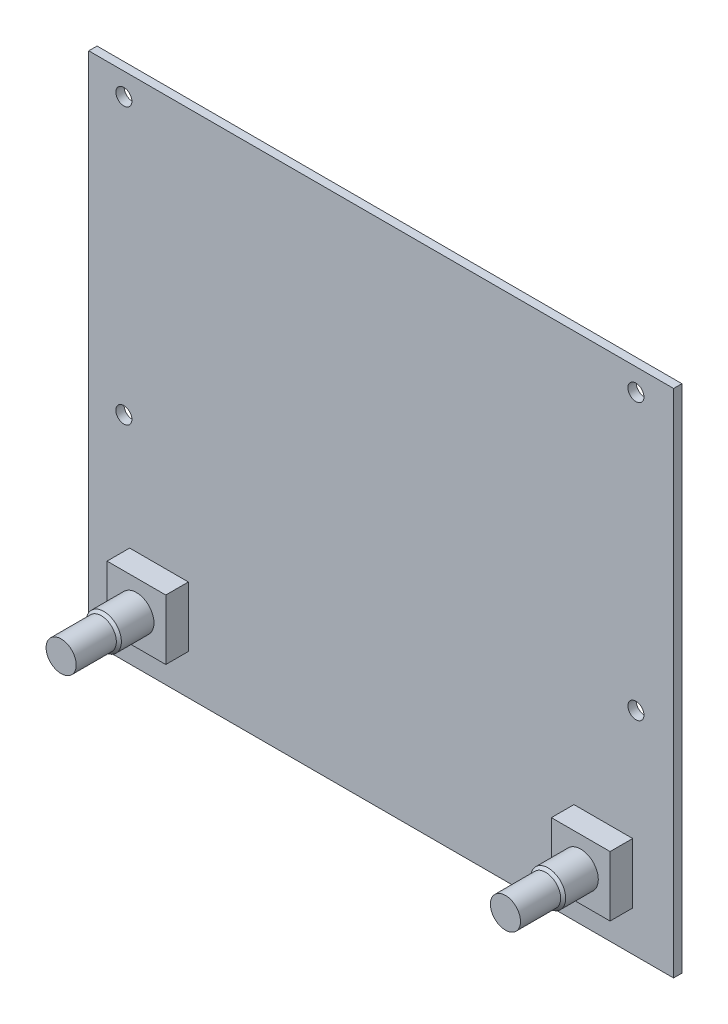
from build123d import *

# Parameters (mm, degrees)
SKETCH1_W           = 116.54028
SKETCH1_H           = 101.7397
SKETCH1_R           = 1.6002
BOSS_EXTRUDE1_DEPTH = 1.65608
SKETCH2_W           = 11.69924
SKETCH2_H           = 11.99896
BOSS_EXTRUDE2_DEPTH = 4.5
SKETCH3_R           = 3.5
BOSS_EXTRUDE3_DEPTH = 7
CHAMFER1_SIZE       = 0.5
SKETCH5_R           = 3
BOSS_EXTRUDE4_DEPTH = 8
SKETCH6_W           = 77.0509
SKETCH6_H           = 20.6502
CUT_EXTRUDE1_DEPTH  = 1


with BuildPart() as part:
    # Sketch1 → Boss-Extrude1 (new body)
    with BuildSketch(Plane.XY):
        Rectangle(SKETCH1_W, SKETCH1_H)
        with Locations((-51.2699, 46.45025)):
            Circle(SKETCH1_R, mode=Mode.SUBTRACT)
        with Locations((50.76952, 46.45025)):
            Circle(SKETCH1_R, mode=Mode.SUBTRACT)
        with Locations((50.76952, -8.44931)):
            Circle(SKETCH1_R, mode=Mode.SUBTRACT)
        with Locations((-51.2699, -8.44931)):
            Circle(SKETCH1_R, mode=Mode.SUBTRACT)
    extrude(amount=BOSS_EXTRUDE1_DEPTH)

    # Sketch2 → Boss-Extrude2 (add)
    with BuildSketch(Plane.XY.offset(1.65608)):
        with Locations((-44.26966, -36.86937)):
            Rectangle(SKETCH2_W, SKETCH2_H)
        with Locations((44.26966, -36.86937)):
            Rectangle(SKETCH2_W, SKETCH2_H)
    extrude(amount=BOSS_EXTRUDE2_DEPTH)

    # Sketch3 → Boss-Extrude3 (add)
    with BuildSketch(Plane.XY.offset(6.15608)):
        with Locations((-44.26966, -36.86937)):
            Circle(SKETCH3_R)
        with Locations((44.26966, -36.86937)):
            Circle(SKETCH3_R)
    extrude(amount=BOSS_EXTRUDE3_DEPTH)

    # Chamfer1
    chamfer1_edges = [part.edges().sort_by_distance(p)[0] for p in [
        (-47.76966, -36.86937, 13.15608),
        (40.76966, -36.86937, 13.15608),
    ]]
    chamfer(chamfer1_edges, length=CHAMFER1_SIZE)

    # Sketch5 → Boss-Extrude4 (add)
    with BuildSketch(Plane.XY.offset(13.15608)):
        with Locations((44.26966, -36.86937)):
            Circle(SKETCH5_R)
        with Locations((-44.26966, -36.86937)):
            Circle(SKETCH5_R)
    extrude(amount=BOSS_EXTRUDE4_DEPTH)

    # Sketch6 → Cut-Extrude1 (cut)
    with BuildSketch(Plane(origin=(0, 0, 0), x_dir=(-1, 0, 0), z_dir=(0, 0, -1))):
        with Locations((0.73025, 26.13025)):
            Rectangle(SKETCH6_W, SKETCH6_H)
    extrude(amount=-CUT_EXTRUDE1_DEPTH, mode=Mode.SUBTRACT)


solid = part.part
